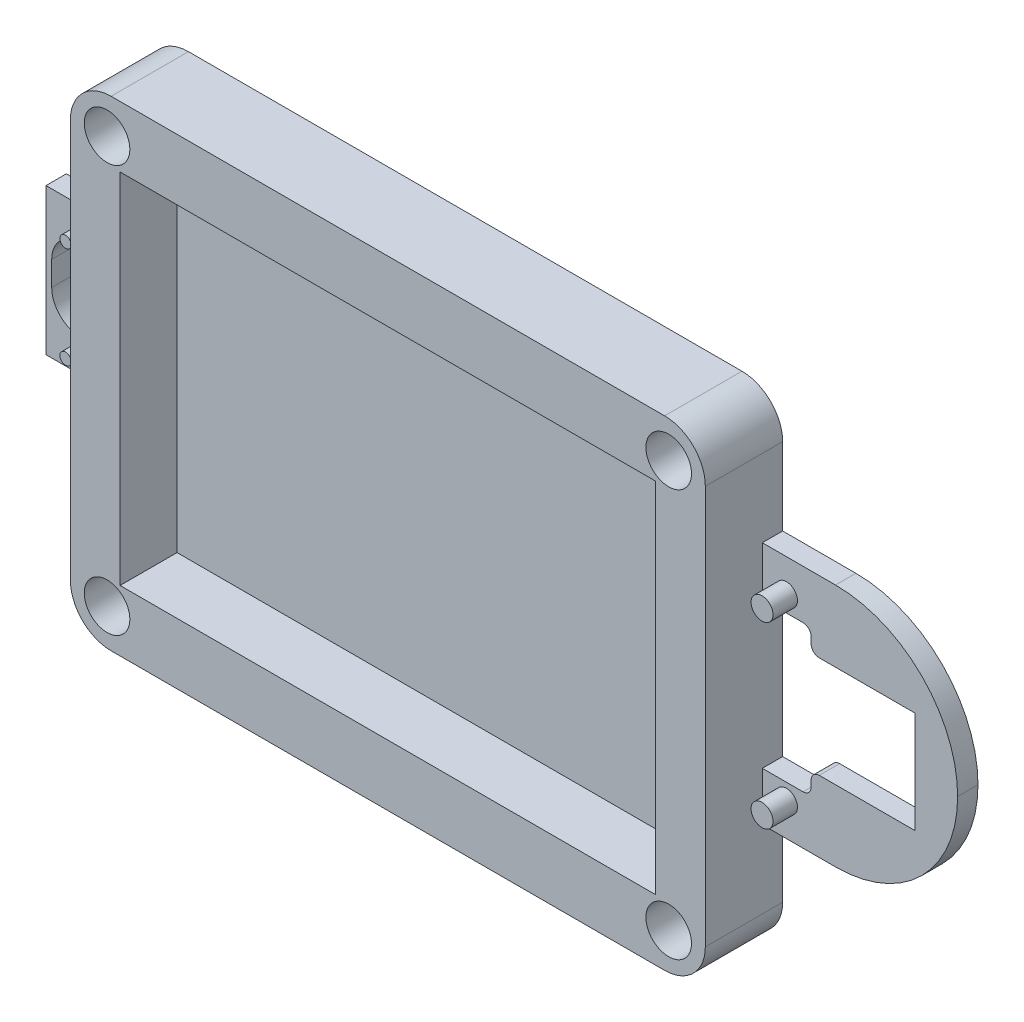
from build123d import *

# Parameters (mm, degrees)
SKETCH1_W               = 55.88
SKETCH1_H               = 83.566
BOSS_EXTRUDE1_DEPTH     = 3.175
SKETCH2_W               = 74.93
SKETCH2_H               = 102.616
SKETCH2_W_2             = 55.88
SKETCH2_H_2             = 83.566
BOSS_EXTRUDE2_DEPTH     = 12.065
CUT_EXTRUDE1_DEPTH      = 65.666075449
CUT_EXTRUDE1_DEPTH_BACK = 65.666075449
SKETCH3_R               = 3.556
CUT_EXTRUDE2_DEPTH      = 65.666075449
CUT_EXTRUDE2_DEPTH_BACK = 65.666075449
SKETCH4_W               = 1.778
SKETCH4_H               = 74.93
FILLET1_R               = 6.35
FILLET2_R               = 0.508
SKETCH5_W               = 38.1
SKETCH5_H               = 3.175
BOSS_EXTRUDE3_DEPTH     = 30.48
CUT_EXTRUDE3_DEPTH      = 89.793346738
CUT_EXTRUDE3_DEPTH_BACK = 89.793346738
SKETCH6_W               = 7.62
SKETCH6_H               = 22.86
SKETCH7_R               = 1.7145
BOSS_EXTRUDE4_DEPTH     = 3.81
CUT_EXTRUDE4_DEPTH      = 89.793346738
CUT_EXTRUDE4_DEPTH_BACK = 89.793346738
SKETCH8_W               = 22.86
SKETCH8_H               = 15.875
SKETCH9_W               = 6.6929
SKETCH9_H               = 15.875
BOSS_EXTRUDE5_DEPTH     = 3.175
FILLET3_R               = 19.05
FILLET5_R               = 1.27
SKETCH10_W              = 22.86
SKETCH10_H              = 3.175
BOSS_EXTRUDE6_DEPTH     = 12.7
CUT_EXTRUDE5_DEPTH      = 89.793346738
CUT_EXTRUDE5_DEPTH_BACK = 89.793346738
SKETCH11_W              = 3.4036
SKETCH11_H              = 14.9352
CUT_EXTRUDE6_DEPTH      = 90.167205575
CUT_EXTRUDE6_DEPTH_BACK = 90.167205575
FILLET7_R               = 0.508
SKETCH13_R              = 0.889
BOSS_EXTRUDE7_DEPTH     = 2.54


with BuildPart() as part:
    # Sketch1 → Boss-Extrude1 (new body)
    with BuildSketch(Plane(origin=(0, 0, 0), x_dir=(0, 1, 0), z_dir=(0, 0, 1))):
        Rectangle(SKETCH1_W, SKETCH1_H)
    extrude(amount=BOSS_EXTRUDE1_DEPTH)

    # Sketch2 → Boss-Extrude2 (add)
    with BuildSketch(Plane(origin=(0, 0, 0), x_dir=(0, 1, 0), z_dir=(0, 0, 1))):
        Rectangle(SKETCH2_W, SKETCH2_H)
        Rectangle(SKETCH2_W_2, SKETCH2_H_2, mode=Mode.SUBTRACT)
    extrude(amount=BOSS_EXTRUDE2_DEPTH)

    # Sketch3 → Cut-Extrude1 (cut, two sides: drawn at the far end of the back side and taken through both)
    with BuildSketch(Plane.XY.offset(12.065).offset(-CUT_EXTRUDE1_DEPTH_BACK)):
        with Locations((-43.815, 31.75)):
            Circle(SKETCH3_R)
        with Locations((43.815, 31.75)):
            Circle(SKETCH3_R)
        with Locations((43.815, -31.75)):
            Circle(SKETCH3_R)
        with Locations((-43.815, -31.75)):
            Circle(SKETCH3_R)
    extrude(amount=CUT_EXTRUDE1_DEPTH + CUT_EXTRUDE1_DEPTH_BACK, mode=Mode.SUBTRACT)

    # Sketch4 → Cut-Extrude2 (cut, two sides: drawn at the far end of the back side and taken through both)
    with BuildSketch(Plane.XY.offset(12.065).offset(-CUT_EXTRUDE2_DEPTH_BACK)):
        with Locations((-50.419, 0)):
            Rectangle(SKETCH4_W, SKETCH4_H)
        with Locations((50.419, 0)):
            Rectangle(SKETCH4_W, SKETCH4_H)
    extrude(amount=CUT_EXTRUDE2_DEPTH + CUT_EXTRUDE2_DEPTH_BACK, mode=Mode.SUBTRACT)

    # Fillet1
    fillet1_edges = [part.edges().sort_by_distance(p)[0] for p in [
        (-49.53, -37.465, 6.0325),
        (-49.53, 37.465, 6.0325),
        (49.53, 37.465, 6.0325),
        (49.53, -37.465, 6.0325),
    ]]
    fillet(fillet1_edges, radius=FILLET1_R)

    # Fillet2
    fillet2_edges = [part.edges().sort_by_distance(p)[0] for p in [
        (-47.371, -31.75, 0),
        (40.259, -31.75, 0),
        (40.259, 31.75, 0),
        (-47.371, 31.75, 0),
    ]]
    fillet(fillet2_edges, radius=FILLET2_R)

    # Sketch5 → Boss-Extrude3 (add)
    with BuildSketch(Plane.YZ.offset(49.53)):
        with Locations((0, 1.5875)):
            Rectangle(SKETCH5_W, SKETCH5_H)
    extrude(amount=BOSS_EXTRUDE3_DEPTH)

    # Sketch6 → Cut-Extrude3 (cut, two sides: drawn at the far end of the back side and taken through both)
    with BuildSketch(Plane.XY.offset(3.175).offset(-CUT_EXTRUDE3_DEPTH_BACK)):
        with Locations((53.34, 0)):
            Rectangle(SKETCH6_W, SKETCH6_H)
    extrude(amount=CUT_EXTRUDE3_DEPTH + CUT_EXTRUDE3_DEPTH_BACK, mode=Mode.SUBTRACT)

    # Sketch7 → Boss-Extrude4 (add)
    with BuildSketch(Plane.XY.offset(3.175)):
        with Locations(Location((53.3019, 13.9573, 0), (0, 0, 180))):
            Circle(SKETCH7_R)
        with Locations(Location((53.3019, -13.9573, 0), (0, 0, 180))):
            Circle(SKETCH7_R)
    extrude(amount=BOSS_EXTRUDE4_DEPTH)

    # Sketch8 → Cut-Extrude4 (cut, two sides: drawn at the far end of the back side and taken through both)
    with BuildSketch(Plane.XY.offset(3.175).offset(-CUT_EXTRUDE4_DEPTH_BACK)):
        with Locations((68.58, 0)):
            Rectangle(SKETCH8_W, SKETCH8_H)
    extrude(amount=CUT_EXTRUDE4_DEPTH + CUT_EXTRUDE4_DEPTH_BACK, mode=Mode.SUBTRACT)

    # Sketch9 → Boss-Extrude5 (add)
    with BuildSketch(Plane.XY.offset(3.175)):
        with Locations((76.66355, 0)):
            Rectangle(SKETCH9_W, SKETCH9_H)
    extrude(amount=-BOSS_EXTRUDE5_DEPTH)

    # Fillet3
    fillet3_edges = [part.edges().sort_by_distance(p)[0] for p in [
        (80.01, -19.05, 1.5875),
        (80.01, 19.05, 1.5875),
    ]]
    fillet(fillet3_edges, radius=FILLET3_R - 0.0001)  # a hair under: the kernel refuses the full size

    # Fillet5
    fillet5_edges = [part.edges().sort_by_distance(p)[0] for p in [
        (57.15, 11.43, 1.5875),
        (57.15, -11.43, 1.5875),
        (57.15, 7.9375, 1.5875),
        (57.15, -7.9375, 1.5875),
    ]]
    fillet(fillet5_edges, radius=FILLET5_R)

    # Sketch10 → Boss-Extrude6 (add)
    with BuildSketch(Plane(origin=(-49.53, 0, 0), x_dir=(0, -1, 0), z_dir=(-1, 0, 0))):
        with Locations((0, 1.5875)):
            Rectangle(SKETCH10_W, SKETCH10_H)
    extrude(amount=BOSS_EXTRUDE6_DEPTH)

    # Sketch11 → Cut-Extrude5 (cut, two sides: drawn at the far end of the back side and taken through both)
    with BuildSketch(Plane.XY.offset(3.175).offset(-CUT_EXTRUDE5_DEPTH_BACK)):
        with Locations((-51.2318, 0)):
            Rectangle(SKETCH11_W, SKETCH11_H)
    extrude(amount=CUT_EXTRUDE5_DEPTH + CUT_EXTRUDE5_DEPTH_BACK, mode=Mode.SUBTRACT)

    # Sketch12 → Cut-Extrude6 (cut, two sides: drawn at the far end of the back side and taken through both)
    with BuildSketch(Plane(origin=(0, 0, 0), x_dir=(1, 0, 0), z_dir=(0, 0, -1)).offset(-CUT_EXTRUDE6_DEPTH_BACK)):
        with BuildLine():
            Line((-52.451, 1.905), (-52.451, -1.905))
            ThreePointArc((-52.451, -1.905), (-56.896, -6.35), (-61.341, -1.905))
            Line((-61.341, -1.905), (-61.341, 1.905))
            ThreePointArc((-61.341, 1.905), (-56.896, 6.35), (-52.451, 1.905))
        make_face()
    extrude(amount=CUT_EXTRUDE6_DEPTH + CUT_EXTRUDE6_DEPTH_BACK, mode=Mode.SUBTRACT)

    # Fillet7
    fillet7_edges = [part.edges().sort_by_distance(p)[0] for p in [
        (-52.9336, 3.919301676, 1.5875),
        (-52.9336, -3.919301676, 1.5875),
    ]]
    fillet(fillet7_edges, radius=FILLET7_R)

    # Sketch13 → Boss-Extrude7 (add)
    with BuildSketch(Plane.XY.offset(3.175)):
        with Locations(Location((-56.642, 7.8994, 0), (0, 0, 90))):
            Circle(SKETCH13_R)
        with Locations(Location((-56.642, -7.8994, 0), (0, 0, 90))):
            Circle(SKETCH13_R)
    extrude(amount=BOSS_EXTRUDE7_DEPTH)


solid = part.part
